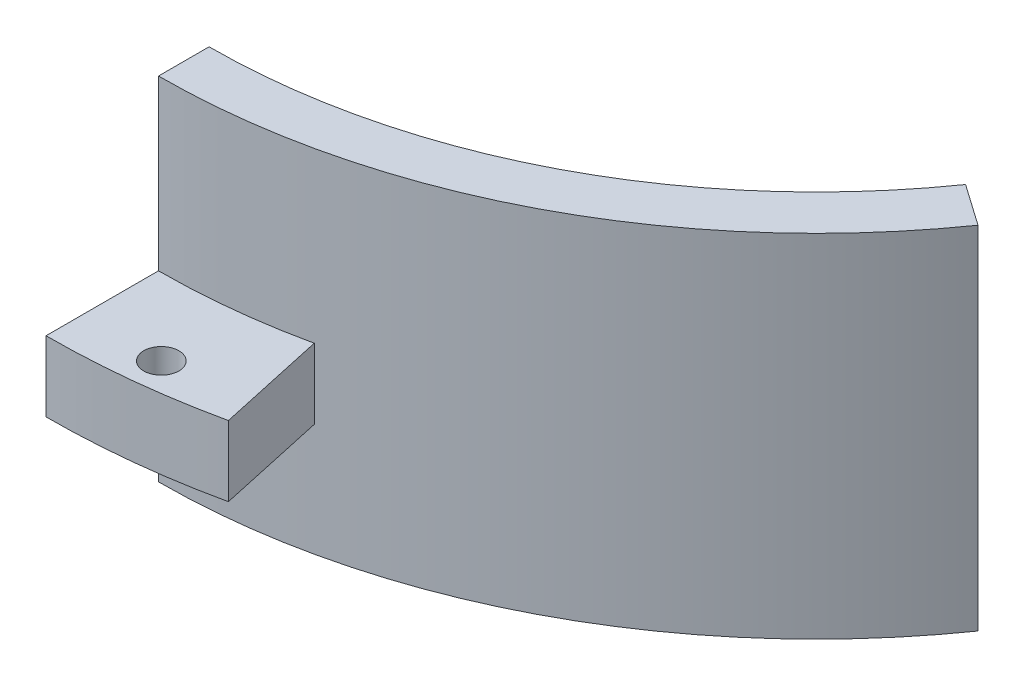
from build123d import *

# Parameters (mm, degrees)
BOSS_EXTRUDE1_DEPTH = 25
BOSS_EXTRUDE2_START = -19
BOSS_EXTRUDE2_DEPTH = 13
BOSS_EXTRUDE3_START = -17
BOSS_EXTRUDE3_DEPTH = 5
M3_TAP_HOLE_REACH   = 70.13
SKETCH5_R           = 1.25
CUT_EXTRUDE1_REACH  = 71.525


with BuildPart() as part:
    # Sketch2 → Boss-Extrude1 (new body)
    with BuildSketch(Plane(origin=(0, 0, 0), x_dir=(1, 0, 0), z_dir=(0, 1, 0))):
        with BuildLine():
            Line((0, -43.2), (0, -46.8))
            ThreePointArc((0, -46.8), (21.609835099, -41.512106993), (38.336315673, -26.843377221))
            Line((38.336315673, -26.843377221), (35.387368313, -24.77850205))
            ThreePointArc((35.387368313, -24.77850205), (19.947540092, -38.318867993), (0, -43.2))
        make_face()
    extrude(amount=BOSS_EXTRUDE1_DEPTH)

    # Sketch3 → Boss-Extrude2 (add)
    with BuildSketch(Plane(origin=(0, 25, 0), x_dir=(1, 0, 0), z_dir=(0, 1, 0)).offset(BOSS_EXTRUDE2_START)):
        with BuildLine():
            Line((0, -40), (0, -43.2))
            ThreePointArc((0, -43.2), (19.947540092, -38.318867993), (35.387368313, -24.77850205))
            Line((35.387368313, -24.77850205), (32.766081772, -22.943057454))
            ThreePointArc((32.766081772, -22.943057454), (18.469944529, -35.480433327), (0, -40))
        make_face()
    extrude(amount=BOSS_EXTRUDE2_DEPTH)

    # Sketch4 → Boss-Extrude3 (add)
    with BuildSketch(Plane(origin=(0, 25, 0), x_dir=(1, 0, 0), z_dir=(0, 1, 0)).offset(BOSS_EXTRUDE3_START)):
        with BuildLine():
            ThreePointArc((10, -45.719142599), (5.029121512, -46.52900103), (0, -46.8))
            Line((0, -46.8), (0, -54.8))
            ThreePointArc((0, -54.8), (5.888800403, -54.482676419), (11.709401709, -53.53438065))
            Line((11.709401709, -53.53438065), (10, -45.719142599))
        make_face()
    extrude(amount=BOSS_EXTRUDE3_DEPTH)

    # Sketch5 → M3-tap-hole (cut, up to next)
    with BuildSketch(Plane(origin=(0, 13, 0), x_dir=(1, 0, 0), z_dir=(0, 1, 0)), mode=Mode.PRIVATE) as m3_tap_hole_sk1:
        with Locations((5.647015715, -52.245705216)):
            Circle(SKETCH5_R)
    m3_tap_hole_tool1 = extrude(m3_tap_hole_sk1.sketch, amount=-M3_TAP_HOLE_REACH, mode=Mode.PRIVATE) & part.part
    add(m3_tap_hole_tool1.solids().sort_by_distance((5.647016, 13, 52.245705))[0], mode=Mode.SUBTRACT)

    # Sketch6 → Cut-Extrude1 (cut, up to next)
    with BuildSketch(Plane(origin=(0, 19, 0), x_dir=(1, 0, 0), z_dir=(0, 1, 0)), mode=Mode.PRIVATE) as cut_extrude1_sk1:
        with BuildLine():
            Line((0, -40), (0, -43))
            Line((0, -43), (5, -39.686269666))
            ThreePointArc((5, -39.686269666), (2.504916502, -39.921490369), (0, -40))
        make_face()
    cut_extrude1_tool1 = extrude(cut_extrude1_sk1.sketch, amount=-CUT_EXTRUDE1_REACH, mode=Mode.PRIVATE) & part.part
    add(cut_extrude1_tool1.solids().sort_by_distance((1.636399, 19, 40.932418))[0], mode=Mode.SUBTRACT)


solid = part.part
